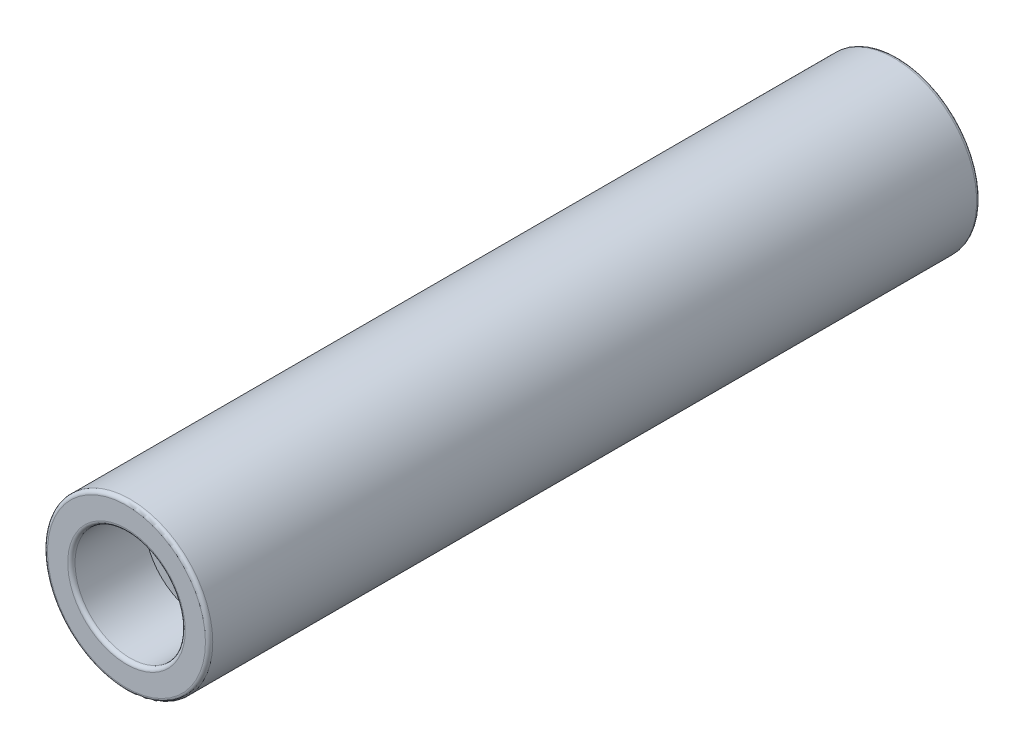
from build123d import *

# Parameters (mm, degrees)
SKETCH1_R           = 4.5
SKETCH1_R_2         = 2.5
EXTRUDE_THIN1_DEPTH = 12
SKETCH11_R          = 4.5
SKETCH11_R_2        = 1.5
EXTRUDE_THIN3_DEPTH = 5
SKETCH12_R          = 4.5
SKETCH12_R_2        = 3
EXTRUDE_THIN4_DEPTH = 4
THREAD1_PITCH       = 0.5
FILLET2_R           = 0.2


# Read off the part's stored shape, not the designer's step: Revolve1
with BuildPart() as part:
    # Sketch1 → Extrude-Thin1 (new body)
    with BuildSketch(Plane.XY):
        Circle(SKETCH1_R)
        Circle(SKETCH1_R_2, mode=Mode.SUBTRACT)
    extrude_thin1 = extrude(amount=EXTRUDE_THIN1_DEPTH)

    # Sketch11 → Extrude-Thin3 (add)
    with BuildSketch(Plane.XY.offset(12)):
        Circle(SKETCH11_R)
        Circle(SKETCH11_R_2, mode=Mode.SUBTRACT)
    extrude_thin3 = extrude(amount=EXTRUDE_THIN3_DEPTH)

    # Sketch12 → Extrude-Thin4 (add)
    with BuildSketch(Plane.XY.offset(17)):
        Circle(SKETCH12_R)
        Circle(SKETCH12_R_2, mode=Mode.SUBTRACT)
    extrude_thin4 = extrude(amount=EXTRUDE_THIN4_DEPTH)

    # Thread1: the profile of Thread Profile1 profile screwed along a right-hand helix of 10 turns, 6 arcs to a turn; built about Z, then put on its axis
    thread1_z = Axis((0, 0, 0), (0, 0, 1))
    thread1_corners = [(1.5003, 0, -0.000173205), (1.5003, 0, 0.437673204), (1.229367063, 0, 0.281249999), (1.229367063, 0, 0.156249999)]
    with BuildLine(mode=Mode.PRIVATE) as thread1_profile:
        Line(thread1_corners[0], thread1_corners[1])
        Line(thread1_corners[1], thread1_corners[2])
        Line(thread1_corners[2], thread1_corners[3])
        Line(thread1_corners[3], thread1_corners[0])
    thread1_cap = Face(thread1_profile.wire())
    thread1_turn_angles = [0, 30, 60, 90, 120, 150, 180, 210, 240, 270, 300, 330, 360]
    thread1_turn_weights = [1, 0.8660254037844387, 1, 0.8660254037844387, 1, 0.8660254037844387, 1, 0.8660254037844387, 1, 0.8660254037844387, 1, 0.8660254037844387, 1]
    thread1_turn_rails = [Edge.make_bspline([Vector(p[0], p[1], 0).rotate(thread1_z, thread1_turn_angles[k]) / thread1_turn_weights[k] + Vector(0, 0, p[2] + THREAD1_PITCH * thread1_turn_angles[k] / 360) for k in range(13)], [0, 0, 0, 1, 1, 2, 2, 3, 3, 4, 4, 5, 5, 6, 6, 6], 2, thread1_turn_weights) for p in thread1_corners]
    thread1_turn_sides = [Face.make_surface_from_curves(thread1_turn_rails[p[0]], thread1_turn_rails[p[1]]) for p in [(0, 1), (1, 2), (2, 3), (3, 0)]]
    thread1 = Plane(origin=(0, 0, 12), x_dir=(1, 0, 0), z_dir=(0, 0, 1)) * Solid(Shell([*[p.moved(Location((0, 0, THREAD1_PITCH * i))) for i in range(10) for p in thread1_turn_sides], thread1_cap, thread1_cap.rotate(thread1_z, 3600).moved(Location((0, 0, THREAD1_PITCH * 3600 / 360)))]))
    add(thread1)

    # Mirror2: Extrude-Thin1, Extrude-Thin3, Extrude-Thin4, Thread1 across plane
    add(extrude_thin1.mirror(Plane.XY))
    add(extrude_thin3.mirror(Plane.XY))
    add(extrude_thin4.mirror(Plane.XY))
    add(thread1.mirror(Plane.XY))

    # Fillet2
    fillet2_edges = [part.edges().sort_by_distance(p)[0] for p in [
        (-4.5, 0, 21),
        (-3, 0, 21),
        (-4.5, 0, -21),
        (-3, 0, -21),
    ]]
    fillet(fillet2_edges, radius=FILLET2_R)

    # Revolve1 outline → Revolve1 (revolve)
    with BuildSketch(Plane.XZ):
        Polygon((2.5, 12), (1.5, 12), (2.5, 11), align=None)
    revolve1 = revolve(axis=Axis((0, 0, 0), (0, 0, 1)))

    # Mirror3: Revolve1 across plane
    add(revolve1.mirror(Plane.XY))


solid = part.part
